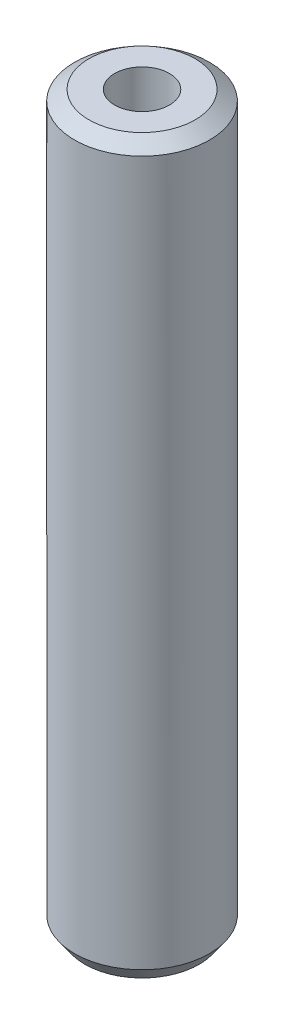
from build123d import *
from OCP.BRepFilletAPI import BRepFilletAPI_MakeChamfer

# Parameters (mm, degrees)
SKETCH1_R           = 30
BOSS_EXTRUDE1_DEPTH = 324.345287153
SKETCH2_R           = 12.188242756
CUT_EXTRUDE1_DEPTH  = 328.108338778
CHAMFER1_SIZE       = 4.565231865
CHAMFER1_SIZE2      = 6.40634981


with BuildPart() as part:
    # Sketch1 → Boss-Extrude1 (new body)
    with BuildSketch(Plane(origin=(0, 0, 0), x_dir=(1, 0, 0), z_dir=(0, 1, 0))):
        Circle(SKETCH1_R)
    extrude(amount=BOSS_EXTRUDE1_DEPTH)

    # Sketch2 → Cut-Extrude1 (cut, through all)
    with BuildSketch(Plane(origin=(0, 0, 0), x_dir=(1, 0, 0), z_dir=(0, 1, 0))):
        Circle(SKETCH2_R)
    extrude(amount=CUT_EXTRUDE1_DEPTH, mode=Mode.SUBTRACT)

    # Chamfer1: one chamfer whose edges measure the first distance from different faces: ONE call of the kernel's chamfer builder (chamfer() names one face for all edges)
    chamfer1_edges_1 = [part.edges().sort_by_distance(p)[0] for p in [
        (-30, 324.345287153, 0),
    ]]
    chamfer1_side_1 = [part.faces().sort_by_distance(p)[0] for p in [
        (-30, 162.172643576, 0),
    ]]
    chamfer1_edges_2 = [part.edges().sort_by_distance(p)[0] for p in [
        (-30, 0, 0),
    ]]
    chamfer1_side_2 = [part.faces().sort_by_distance(p)[0] for p in [
        (-29.151471863, 0, 0),
    ]]
    chamfer1 = BRepFilletAPI_MakeChamfer(part.part.solid().wrapped)
    for e in chamfer1_edges_1:
        chamfer1.Add(CHAMFER1_SIZE, CHAMFER1_SIZE2, e.wrapped, chamfer1_side_1[0].wrapped)  # the first distance lies on this face
    for e in chamfer1_edges_2:
        chamfer1.Add(CHAMFER1_SIZE, CHAMFER1_SIZE2, e.wrapped, chamfer1_side_2[0].wrapped)  # the first distance lies on this face
    add(Compound.cast(chamfer1.Shape()), mode=Mode.REPLACE)


solid = part.part
